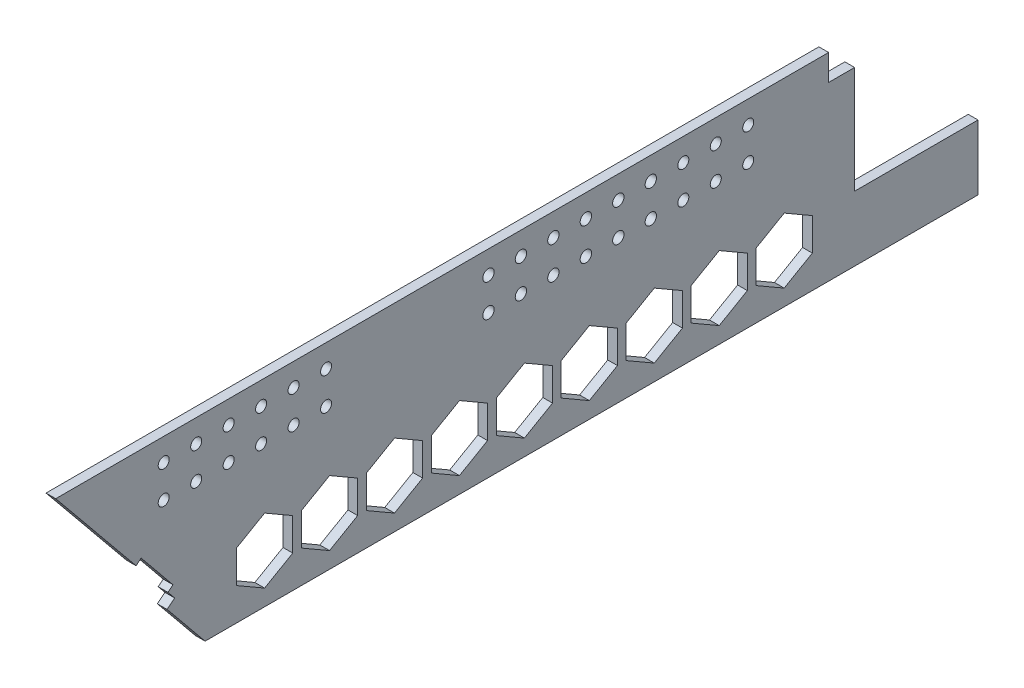
from build123d import *

# Parameters (mm, degrees)
SKETCH1_W                      = 3
SKETCH1_H                      = 76
BOSS_EXTRUDE1_DEPTH            = 220
M3_CLEARANCE_HOLE1_D           = 3.4
M3_CLEARANCE_HOLE1_CSINK_D     = 3.45
M3_CLEARANCE_HOLE1_CSINK_ANGLE = 90
SKETCH4_W                      = 220
SKETCH4_H                      = 15
CUT_EXTRUDE1_DEPTH             = 233.776717049
SKETCH5_R                      = 1.75
CUT_EXTRUDE2_DEPTH             = 233.776717049
BOSS_EXTRUDE2_START            = -3
SKETCH6_R                      = 1.725
SKETCH6_R_2                    = 1.7
BOSS_EXTRUDE2_DEPTH            = 3
BOSS_EXTRUDE3_DEPTH            = 3
CUT_EXTRUDE3_DEPTH             = 10
LPATTERN1_COUNT                = 3
LPATTERN1_PITCH                = 20
CUT_EXTRUDE4_DEPTH             = 10


with BuildPart() as part:
    # Sketch1 → Boss-Extrude1 (new body)
    with BuildSketch(Plane.XY):
        with Locations((1.5, 38)):
            Rectangle(SKETCH1_W, SKETCH1_H)
    extrude(amount=BOSS_EXTRUDE1_DEPTH)

    # M3 Clearance Hole1 (through all)
    with Locations(Plane.ZY):
        with Locations((50.754682085, 59), (60.754682085, 59), (60.754682085, 69), (50.754682085, 69), (200.754682085, 59), (200.754682085, 69), (210.754682085, 59), (210.754682085, 69)):
            m3_clearance_hole1 = CounterSinkHole(M3_CLEARANCE_HOLE1_D / 2, M3_CLEARANCE_HOLE1_CSINK_D / 2, counter_sink_angle=M3_CLEARANCE_HOLE1_CSINK_ANGLE)

    # Sketch4 → Cut-Extrude1 (cut, through all)
    with BuildSketch(Plane.ZY):
        with Locations((110, 7.5)):
            Rectangle(SKETCH4_W, SKETCH4_H)
    extrude(amount=-CUT_EXTRUDE1_DEPTH, mode=Mode.SUBTRACT)

    # Sketch5 → Cut-Extrude2 (cut, through all)
    with BuildSketch(Plane.ZY):
        with Locations((110.754682085, 69)):
            Circle(SKETCH5_R)
        with Locations((100.754682085, 69)):
            Circle(SKETCH5_R)
        with Locations((100.754682085, 59)):
            Circle(SKETCH5_R)
        with Locations((110.754682085, 59)):
            Circle(SKETCH5_R)
    cut_extrude2 = extrude(amount=-CUT_EXTRUDE2_DEPTH, mode=Mode.SUBTRACT)

    # Sketch6 → Boss-Extrude2 (add)
    with BuildSketch(Plane.ZY.offset(BOSS_EXTRUDE2_START)):
        with Locations((50.754682085, 59)):
            Circle(SKETCH6_R)
        with Locations((60.754682085, 59)):
            Circle(SKETCH6_R_2)
        with Locations((60.754682085, 69)):
            Circle(SKETCH6_R)
        with Locations((50.754682085, 69)):
            Circle(SKETCH6_R)
    extrude(amount=BOSS_EXTRUDE2_DEPTH)

    # Sketch7 → Boss-Extrude3 (add)
    with BuildSketch(Plane.ZY):
        Polygon((220, 76), (284, 76), (259.255982343, 45.736716068), (257.707645299, 47.00267515), (247.896462411, 35.003063059), (249.444799455, 33.737103977), (247.387615946, 31.22105628), (249.710121512, 29.322117657), (238, 15), (220, 15), align=None)
    extrude(amount=-BOSS_EXTRUDE3_DEPTH)

    # Sketch8 → Cut-Extrude3 (cut)
    with BuildSketch(Plane.ZY):
        Polygon((0, 76), (46, 76), (46, 68), (38, 68), (38, 35), (0, 35), align=None)
    extrude(amount=-CUT_EXTRUDE3_DEPTH, mode=Mode.SUBTRACT)

    # LPattern1: M3 Clearance Hole1, Cut-Extrude2 ×3
    with Locations(*[(0, 0, i * LPATTERN1_PITCH) for i in range(1, LPATTERN1_COUNT)]):
        add(m3_clearance_hole1, mode=Mode.SUBTRACT)
        add(cut_extrude2, mode=Mode.SUBTRACT)

    # Sketch9 → Cut-Extrude4 (cut)
    with BuildSketch(Plane.ZY):
        Polygon((59.682015207, 20), (68.342269245, 25), (68.342269245, 35), (59.682015207, 40), (51.021761169, 35), (51.021761169, 25), align=None)
        Polygon((79.682015207, 40), (71.021761169, 35), (71.021761169, 25), (79.682015207, 20), (88.342269245, 25), (88.342269245, 35), align=None)
        Polygon((99.682015207, 40), (91.021761169, 35), (91.021761169, 25), (99.682015207, 20), (108.342269245, 25), (108.342269245, 35), align=None)
        Polygon((119.682015207, 40), (111.021761169, 35), (111.021761169, 25), (119.682015207, 20), (128.342269245, 25), (128.342269245, 35), align=None)
        Polygon((139.682015207, 40), (131.021761169, 35), (131.021761169, 25), (139.682015207, 20), (148.342269245, 25), (148.342269245, 35), align=None)
        Polygon((159.682015207, 40), (151.021761169, 35), (151.021761169, 25), (159.682015207, 20), (168.342269245, 25), (168.342269245, 35), align=None)
        Polygon((179.682015207, 40), (171.021761169, 35), (171.021761169, 25), (179.682015207, 20), (188.342269245, 25), (188.342269245, 35), align=None)
        Polygon((199.682015207, 40), (191.021761169, 35), (191.021761169, 25), (199.682015207, 20), (208.342269245, 25), (208.342269245, 35), align=None)
        Polygon((219.682015207, 40), (211.021761169, 35), (211.021761169, 25), (219.682015207, 20), (228.342269245, 25), (228.342269245, 35), align=None)
    extrude(amount=-CUT_EXTRUDE4_DEPTH, mode=Mode.SUBTRACT)


solid = part.part
